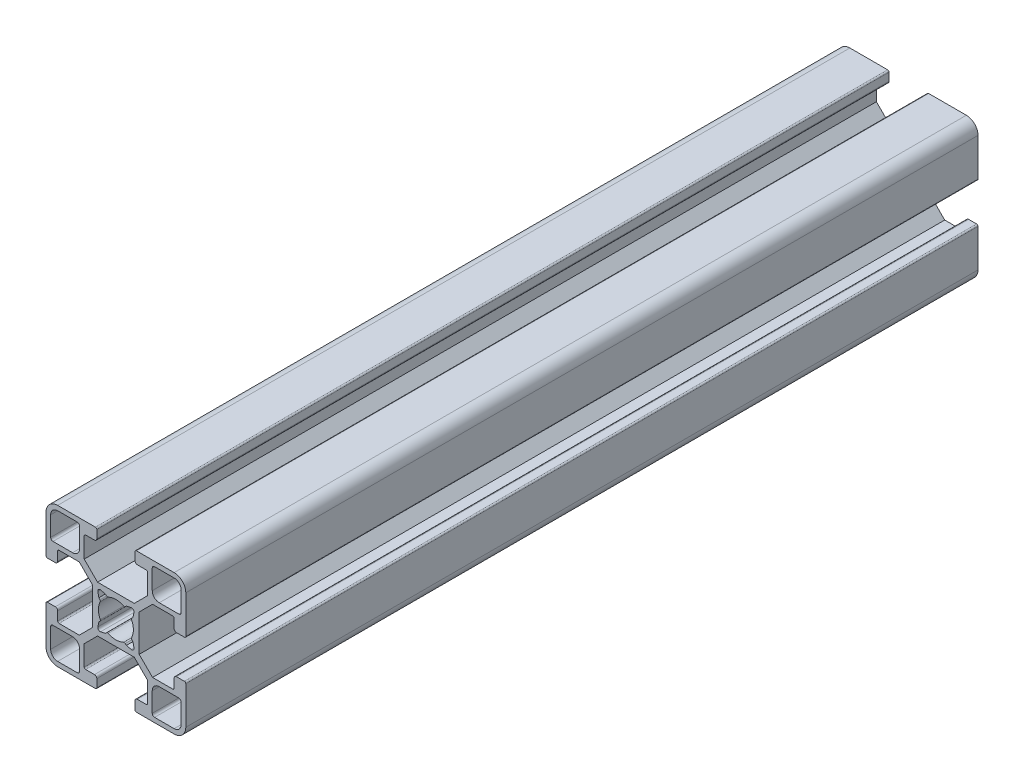
from build123d import *

# Parameters (mm, degrees)
BOSS_EXTRUDE1_DEPTH = 85


with BuildPart() as part:
    # Sketch1 → Boss-Extrude1 (new, symmetric)
    with BuildSketch(Plane.XY):
        with BuildLine():
            Line((21.799990977, 7.139350412), (18.939335294, 10.000004729))
            Line((18.939335294, 10.000004729), (11.060654294, 10.000000095))
            Line((11.060654294, 10.000000095), (8.200000977, 7.139342412))
            Line((8.200000977, 7.139342412), (8.200003529, 2.800001412))
            ThreePointArc((8.200003529, 2.800001412), (8.28786862, 2.587867672), (8.500000706, 2.499998588))
            Line((8.500000706, 2.499998588), (10.400000706, 2.499999706))
            ThreePointArc((10.400000706, 2.499999706), (10.753554287, 2.353553201), (10.900001, 1.999999706))
            Line((10.900001, 1.999999706), (10.900001, 0.299996823))
            ThreePointArc((10.900001, 0.299996823), (10.812134558, 0.087867732), (10.600006, 0))
            Line((10.600006, 0), (2.5, 0))
            ThreePointArc((2.5, 0), (0.732233047, 0.732233047), (0, 2.5))
            Line((0, 2.5), (0, 10.600006))
            ThreePointArc((0, 10.600006), (0.087869562, 10.812137388), (0.300003, 10.900002))
            Line((0.300003, 10.900002), (2, 10.900002))
            ThreePointArc((2, 10.900002), (2.353553391, 10.753555391), (2.5, 10.400002))
            Line((2.5, 10.400002), (2.5, 8.500002))
            ThreePointArc((2.5, 8.500002), (2.587869099, 8.287870075), (2.80000269, 8.200005))
            Line((2.80000269, 8.200005), (7.139344, 8.200005))
            Line((7.139344, 8.200005), (10, 11.06066))
            Line((10, 11.06066), (10, 18.939341))
            Line((10, 18.939341), (7.139344, 21.799995))
            Line((7.139344, 21.799995), (2.800003, 21.799995))
            ThreePointArc((2.800003, 21.799995), (2.587869208, 21.712130034), (2.5, 21.499998))
            Line((2.5, 21.499998), (2.5, 19.59999775))
            ThreePointArc((2.5, 19.59999775), (2.353553161, 19.246444027), (1.999999309, 19.0999975))
            Line((1.999999309, 19.0999975), (0.299996735, 19.099999))
            ThreePointArc((0.299996735, 19.099999), (0.087867778, 19.187865661), (2.65e-07, 19.399994265))
            Line((2.65e-07, 19.399994265), (2.65e-07, 27.500000265))
            ThreePointArc((2.65e-07, 27.500000265), (0.732233312, 29.267767218), (2.500000265, 30.000000265))
            Line((2.500000265, 30.000000265), (10.6000062, 30.000000265))
            ThreePointArc((10.6000062, 30.000000265), (10.812136906, 29.912130185), (10.900001, 29.699997))
            Line((10.900001, 29.699997), (10.900001, 28))
            ThreePointArc((10.900001, 28), (10.75355439, 27.646446609), (10.400001, 27.5))
            Line((10.400001, 27.5), (8.499999, 27.5))
            ThreePointArc((8.499999, 27.5), (8.287868368, 27.412130194), (8.200004, 27.19999731))
            Line((8.200004, 27.19999731), (8.200004, 22.860655))
            Line((8.200004, 22.860655), (11.060659, 20))
            Line((11.060659, 20), (18.93934, 20))
            Line((18.93934, 20), (21.799994, 22.860655))
            Line((21.799994, 22.860655), (21.799994, 27.199997))
            ThreePointArc((21.799994, 27.199997), (21.712129034, 27.412130792), (21.499997, 27.5))
            Line((21.499997, 27.5), (19.599981706, 27.5))
            ThreePointArc((19.599981706, 27.5), (19.246428419, 27.646446505), (19.099981706, 27.999999706))
            Line((19.099981706, 27.999999706), (19.099980706, 29.700007823))
            ThreePointArc((19.099980706, 29.700007823), (19.187847107, 29.912137435), (19.399976029, 30.0000055))
            Line((19.399976029, 30.0000055), (27.499982029, 30.0000055))
            ThreePointArc((27.499982029, 30.0000055), (29.267764732, 29.267777107), (30.0000055, 27.499999529))
            Line((30.0000055, 27.499999529), (30.0000055, 19.399993594))
            ThreePointArc((30.0000055, 19.399993594), (29.912142492, 19.187844223), (29.6999965, 19.099973058))
            Line((29.6999965, 19.099973058), (27.9999995, 19.099974558))
            ThreePointArc((27.9999995, 19.099974558), (27.646437821, 19.246429455), (27.4999995, 19.599998))
            Line((27.4999995, 19.599998), (27.4999995, 21.5))
            ThreePointArc((27.4999995, 21.5), (27.412129694, 21.712130632), (27.19999681, 21.799995))
            Line((27.19999681, 21.799995), (22.8606545, 21.799995))
            Line((22.8606545, 21.799995), (19.9999995, 18.939341))
            Line((19.9999995, 18.939341), (19.9999995, 11.06066))
            Line((19.9999995, 11.06066), (22.8606545, 8.200005))
            Line((22.8606545, 8.200005), (27.1999965, 8.200005))
            ThreePointArc((27.1999965, 8.200005), (27.412129603, 8.287869277), (27.4999995, 8.500000051))
            Line((27.4999995, 8.500000051), (27.4999995, 10.400002))
            ThreePointArc((27.4999995, 10.400002), (27.646446109, 10.753555391), (27.9999995, 10.900002))
            Line((27.9999995, 10.900002), (29.7000025, 10.900002))
            ThreePointArc((29.7000025, 10.900002), (29.912129264, 10.812133269), (29.999995, 10.600005265))
            Line((29.999995, 10.600005265), (29.999995, 2.499999265))
            ThreePointArc((29.999995, 2.499999265), (29.26776322, 0.732236385), (27.500000177, 5e-06))
            Line((27.500000177, 5e-06), (19.399994245, 5e-06))
            ThreePointArc((19.399994245, 5e-06), (19.187862761, 0.087874413), (19.099998, 0.300007824))
            Line((19.099998, 0.300007824), (19.099997, 2.000004824))
            ThreePointArc((19.099997, 2.000004824), (19.246443401, 2.3535583), (19.599996706, 2.500005118))
            Line((19.599996706, 2.500005118), (21.499998706, 2.500006235))
            ThreePointArc((21.499998706, 2.500006235), (21.712129286, 2.587876166), (21.799993529, 2.800009102))
            Line((21.799993529, 2.800009102), (21.799990977, 7.139350412))
        make_face()
        with BuildLine():
            Line((18.878868942, 11.714100014), (18.657285002, 12.75690673))
            Line((18.657285002, 12.75690673), (18.419345869, 12.994846743))
            ThreePointArc((18.419345869, 12.994846743), (18.335473622, 13.158180995), (18.362480424, 13.339793948))
            ThreePointArc((18.362480424, 13.339793948), (18.750006156, 14.99998656), (18.362487962, 16.660180933))
            ThreePointArc((18.362487962, 16.660180933), (18.335481889, 16.841794157), (18.419354758, 17.005128271))
            Line((18.419354758, 17.005128271), (18.657294593, 17.243067582))
            Line((18.657294593, 17.243067582), (18.878893628, 18.28587109))
            ThreePointArc((18.878893628, 18.28587109), (18.743367928, 18.743355263), (18.285883756, 18.878880962))
            Line((18.285883756, 18.878880962), (17.243080247, 18.657281928))
            Line((17.243080247, 18.657281928), (17.005140412, 18.419342617))
            ThreePointArc((17.005140412, 18.419342617), (16.84180664, 18.335470316), (16.660194009, 18.362476539))
            ThreePointArc((16.660194009, 18.362476539), (15.00000526, 18.749996344), (13.339816433, 18.362476869))
            ThreePointArc((13.339816433, 18.362476869), (13.158203164, 18.335470716), (12.994869031, 18.419343671))
            Line((12.994869031, 18.419343671), (12.756929898, 18.657283684))
            Line((12.756929898, 18.657283684), (11.714126233, 18.878881984))
            ThreePointArc((11.714126233, 18.878881984), (11.256641967, 18.743355772), (11.121116891, 18.28587117))
            Line((11.121116891, 18.28587117), (11.342717777, 17.243068055))
            Line((11.342717777, 17.243068055), (11.580656587, 17.00512772))
            ThreePointArc((11.580656587, 17.00512772), (11.664528478, 16.841794182), (11.637522309, 16.660181943))
            ThreePointArc((11.637522309, 16.660181943), (11.250003617, 14.999998075), (11.637519652, 13.339813587))
            ThreePointArc((11.637519652, 13.339813587), (11.664525497, 13.15820068), (11.580652734, 12.994866901))
            Line((11.580652734, 12.994866901), (11.342712898, 12.75692759))
            Line((11.342712898, 12.75692759), (11.12111194, 11.71412449))
            ThreePointArc((11.12111194, 11.71412449), (11.256636795, 11.256640068), (11.714120718, 11.121113524))
            Line((11.714120718, 11.121113524), (12.756924635, 11.342710635))
            Line((12.756924635, 11.342710635), (12.99486447, 11.580649946))
            ThreePointArc((12.99486447, 11.580649946), (13.158198441, 11.66452228), (13.339811235, 11.637515845))
            ThreePointArc((13.339811235, 11.637515845), (14.999988879, 11.249993804), (16.660169832, 11.637501672))
            ThreePointArc((16.660169832, 11.637501672), (16.841782614, 11.664506717), (17.005115943, 11.580633605))
            Line((17.005115943, 11.580633605), (17.243054753, 11.34269327))
            Line((17.243054753, 11.34269327), (18.285858839, 11.12109695))
            ThreePointArc((18.285858839, 11.12109695), (18.743339639, 11.256620822), (18.878868942, 11.714100014))
        make_face(mode=Mode.SUBTRACT)
        with BuildLine():
            Line((23.299995, 1), (27.5, 1))
            ThreePointArc((27.5, 1), (28.560660172, 1.439339828), (29, 2.5))
            Line((29, 2.5), (29, 6.700005))
            ThreePointArc((29, 6.700005), (28.853553391, 7.053558391), (28.5, 7.200005))
            Line((28.5, 7.200005), (24.299995, 7.200005))
            ThreePointArc((24.299995, 7.200005), (23.239334828, 6.760665172), (22.799995, 5.700005))
            Line((22.799995, 5.700005), (22.799995, 1.5))
            ThreePointArc((22.799995, 1.5), (22.946441609, 1.146446609), (23.299995, 1))
        make_face(mode=Mode.SUBTRACT)
        with BuildLine():
            Line((2.5, 1), (6.700005, 1))
            ThreePointArc((6.700005, 1), (7.05355839, 1.146446609), (7.200005, 1.5))
            Line((7.200005, 1.5), (7.200005, 5.700005))
            ThreePointArc((7.200005, 5.700005), (6.760665172, 6.760665172), (5.700005, 7.200005))
            Line((5.700005, 7.200005), (1.5, 7.200005))
            ThreePointArc((1.5, 7.200005), (1.146446609, 7.053558391), (1, 6.700005))
            Line((1, 6.700005), (1, 2.5))
            ThreePointArc((1, 2.5), (1.439339828, 1.439339828), (2.5, 1))
        make_face(mode=Mode.SUBTRACT)
        with BuildLine():
            Line((1.500000265, 22.799995265), (5.700005, 22.799995265))
            ThreePointArc((5.700005, 22.799995265), (6.760665172, 23.239335093), (7.200005, 24.299995265))
            Line((7.200005, 24.299995265), (7.200005, 28.500000265))
            ThreePointArc((7.200005, 28.500000265), (7.053558484, 28.853553562), (6.700005265, 29.000000265))
            Line((6.700005265, 29.000000265), (2.500000265, 29.000000265))
            ThreePointArc((2.500000265, 29.000000265), (1.439340093, 28.560660437), (1.000000265, 27.500000265))
            Line((1.000000265, 27.500000265), (1.000000265, 23.299995265))
            ThreePointArc((1.000000265, 23.299995265), (1.146446874, 22.946441874), (1.500000265, 22.799995265))
        make_face(mode=Mode.SUBTRACT)
        with BuildLine():
            Line((24.299995265, 22.799995265), (28.500000265, 22.799995265))
            ThreePointArc((28.500000265, 22.799995265), (28.853553655, 22.946441874), (29.000000265, 23.299995265))
            Line((29.000000265, 23.299995265), (29.000000265, 27.500000265))
            ThreePointArc((29.000000265, 27.500000265), (28.560660437, 28.560660437), (27.500000265, 29.000000265))
            Line((27.500000265, 29.000000265), (23.299995265, 29.000000265))
            ThreePointArc((23.299995265, 29.000000265), (22.946441874, 28.853553655), (22.799995265, 28.500000265))
            Line((22.799995265, 28.500000265), (22.799995265, 24.299995265))
            ThreePointArc((22.799995265, 24.299995265), (23.239335093, 23.239335093), (24.299995265, 22.799995265))
        make_face(mode=Mode.SUBTRACT)
    extrude(amount=BOSS_EXTRUDE1_DEPTH, both=True)


solid = part.part
